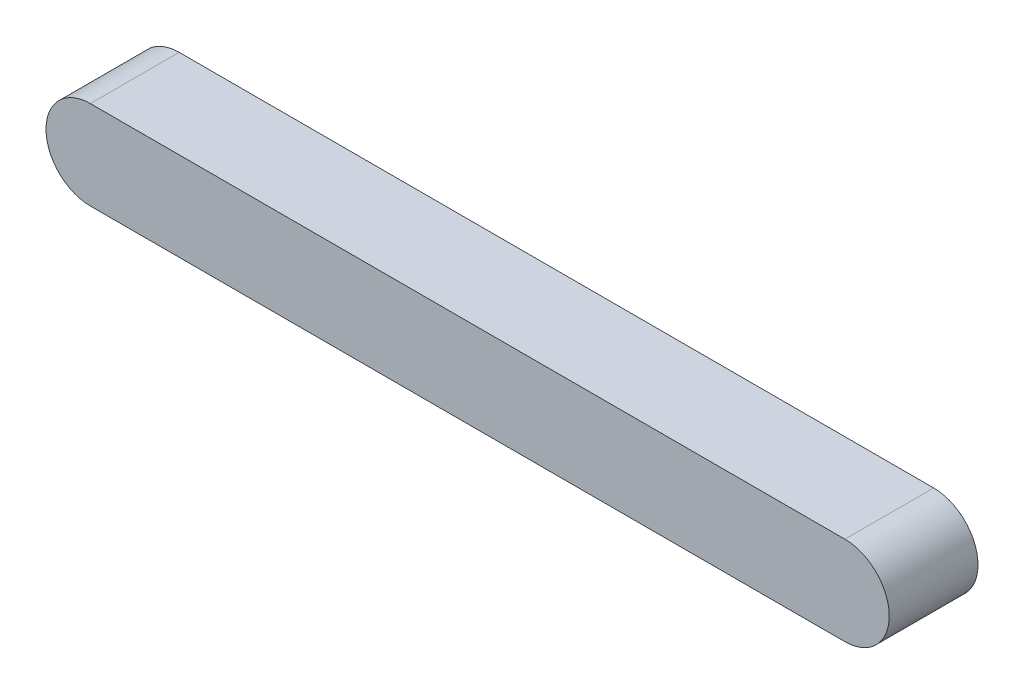
from build123d import *

# Parameters (mm, degrees)
BOSS_EXTRUDE1_DEPTH = 12.7
CUT_EXTRUDE1_DEPTH  = 6.35
CUT_EXTRUDE4_START  = 3.81
CUT_EXTRUDE4_DEPTH  = 3.81
CUT_EXTRUDE5_DEPTH  = 5.08
SKETCH5_R           = 5.08
CUT_EXTRUDE6_DEPTH  = 6.35


# Read off the part's stored shape, not the designer's step: Cut-Extrude5
with BuildPart() as part:
    # Sketch1 → Boss-Extrude1 (new body)
    with BuildSketch(Plane.XY):
        with BuildLine():
            Line((0, 0), (107.95, 0))
            ThreePointArc((107.95, 0), (114.3, -6.35), (107.95, -12.7))
            Line((107.95, -12.7), (0, -12.7))
            ThreePointArc((0, -12.7), (-6.35, -6.35), (0, 0))
        make_face()
    extrude(amount=-BOSS_EXTRUDE1_DEPTH)

    # Sketch2 → Cut-Extrude1 (cut)
    with BuildSketch(Plane(origin=(0, 0, -12.7), x_dir=(-1, 0, 0), z_dir=(0, 0, -1))):
        with BuildLine():
            Line((-98.543781691, -5.269443984), (-97.020546117, -5.269443984))
            ThreePointArc((-97.020546117, -5.269443984), (-94.03507736, -3.175), (-91.049608603, -5.269443984))
            Line((-91.049608603, -5.269443984), (-89.526373029, -5.269443984))
            Line((-89.526373029, -5.269443984), (-89.526373029, -7.430556016))
            Line((-89.526373029, -7.430556016), (-91.049608603, -7.430556016))
            ThreePointArc((-91.049608603, -7.430556016), (-94.03507736, -9.525), (-97.020546117, -7.430556016))
            Line((-97.020546117, -7.430556016), (-98.543781691, -7.430556016))
            Line((-98.543781691, -7.430556016), (-98.543781691, -5.269443984))
        make_face()
        with BuildLine():
            Line((-18.423626971, -5.269443984), (-18.423626971, -7.430556016))
            Line((-18.423626971, -7.430556016), (-16.900391397, -7.430556016))
            ThreePointArc((-16.900391397, -7.430556016), (-13.91492264, -9.525), (-10.929453883, -7.430556016))
            Line((-10.929453883, -7.430556016), (-9.406218309, -7.430556016))
            Line((-9.406218309, -7.430556016), (-9.406218309, -5.269443984))
            Line((-9.406218309, -5.269443984), (-10.929453883, -5.269443984))
            ThreePointArc((-10.929453883, -5.269443984), (-13.91492264, -3.175), (-16.900391397, -5.269443984))
            Line((-16.900391397, -5.269443984), (-18.423626971, -5.269443984))
        make_face()
    extrude(amount=-CUT_EXTRUDE1_DEPTH, mode=Mode.SUBTRACT)

    # Sketch3 → Cut-Extrude4 (cut)
    with BuildSketch(Plane(origin=(0, 0, -6.35), x_dir=(-1, 0, 0), z_dir=(0, 0, -1)).offset(CUT_EXTRUDE4_START)):
        with BuildLine():
            ThreePointArc((-14.99442264, -1.777413667), (-11.444937607, -2.353371426), (-9.342336307, -5.2705))
            Line((-9.342336307, -5.2705), (-10.929071882, -5.2705))
            ThreePointArc((-10.929071882, -5.2705), (-12.566929092, -3.475362911), (-14.99442264, -3.364149242))
            Line((-14.99442264, -3.364149242), (-14.99442264, -1.777413667))
        make_face()
        with BuildLine():
            ThreePointArc((-12.834322649, -10.922326506), (-16.383098929, -10.347745843), (-18.486790701, -7.432537968))
            Line((-18.486790701, -7.432537968), (-16.900008973, -7.431612032))
            ThreePointArc((-16.900008973, -7.431612032), (-15.26155345, -9.225275719), (-12.834704368, -9.335590978))
            Line((-12.834704368, -9.335590978), (-12.834322649, -10.922326506))
        make_face()
        with BuildLine():
            ThreePointArc((-95.115295632, -9.335590978), (-92.68844655, -9.225275719), (-91.049991027, -7.431612032))
            Line((-91.049991027, -7.431612032), (-89.463209299, -7.432537968))
            ThreePointArc((-89.463209299, -7.432537968), (-91.566901071, -10.347745843), (-95.115677351, -10.922326506))
            Line((-95.115677351, -10.922326506), (-95.115295632, -9.335590978))
        make_face()
        with BuildLine():
            ThreePointArc((-92.95557736, -3.364149242), (-95.383070908, -3.475362911), (-97.020928118, -5.2705))
            Line((-97.020928118, -5.2705), (-98.607663693, -5.2705))
            ThreePointArc((-98.607663693, -5.2705), (-96.505062393, -2.353371426), (-92.95557736, -1.777413667))
            Line((-92.95557736, -1.777413667), (-92.95557736, -3.364149242))
        make_face()
    extrude(amount=-CUT_EXTRUDE4_DEPTH, mode=Mode.SUBTRACT)

    # Cut-Extrude5 outline → Cut-Extrude5 (cut)
    with BuildSketch(Plane(origin=(0, 0, -6.35), x_dir=(-1, 0, 0), z_dir=(0, 0, -1))):
        with BuildLine():
            ThreePointArc((-9.342336307, -5.2705), (-11.444937607, -2.353371426), (-14.99442264, -1.777413667))
            Line((-14.99442264, -1.777413667), (-14.99442264, -3.364149242))
            ThreePointArc((-14.99442264, -3.364149242), (-12.567437486, -3.475124566), (-10.929453883, -5.269443984))
            Line((-10.929453883, -5.269443984), (-9.406218309, -5.269443984))
            Line((-9.406218309, -5.269443984), (-9.406218309, -5.2705))
            Line((-9.406218309, -5.2705), (-9.342336307, -5.2705))
        make_face()
        with BuildLine():
            ThreePointArc((-18.486790701, -7.432537968), (-16.383098929, -10.347745843), (-12.834322649, -10.922326506))
            Line((-12.834322649, -10.922326506), (-12.834704368, -9.335590978))
            ThreePointArc((-12.834704368, -9.335590978), (-12.835063496, -9.335720889), (-12.83542264, -9.335850758))
            Line((-12.83542264, -9.335850758), (-12.83542264, -10.796172665))
            Line((-12.83542264, -10.796172665), (-14.99442264, -10.796172665))
            Line((-14.99442264, -10.796172665), (-14.99442264, -9.335850758))
            ThreePointArc((-14.99442264, -9.335850758), (-16.159192409, -8.595858011), (-16.900008973, -7.431612032))
            Line((-16.900008973, -7.431612032), (-18.486790701, -7.432537968))
        make_face()
        with BuildLine():
            ThreePointArc((-95.11457736, -3.364149242), (-94.03507736, -3.175), (-92.95557736, -3.364149242))
            Line((-92.95557736, -3.364149242), (-92.95557736, -1.651))
            Line((-92.95557736, -1.651), (-95.11457736, -1.651))
            Line((-95.11457736, -1.651), (-95.11457736, -3.364149242))
        make_face()
        with BuildLine():
            Line((-92.95557736, -10.796172665), (-92.95557736, -9.335850758))
            ThreePointArc((-92.95557736, -9.335850758), (-94.03507736, -9.525), (-95.11457736, -9.335850758))
            Line((-95.11457736, -9.335850758), (-95.11457736, -10.796172665))
            Line((-95.11457736, -10.796172665), (-92.95557736, -10.796172665))
        make_face()
    extrude(amount=CUT_EXTRUDE5_DEPTH, mode=Mode.SUBTRACT)

    # Sketch5 → Cut-Extrude6 (cut)
    with BuildSketch(Plane(origin=(0, -12.7, 0), x_dir=(1, 0, 0), z_dir=(0, 1, 0))):
        with Locations(Location((81.915, 6.35, 0), (0, 0, 270))):
            Circle(SKETCH5_R)
        with Locations(Location((26.035, 6.35, 0), (0, 0, 90))):
            Circle(SKETCH5_R)
    extrude(amount=CUT_EXTRUDE6_DEPTH, mode=Mode.SUBTRACT)


solid = part.part
